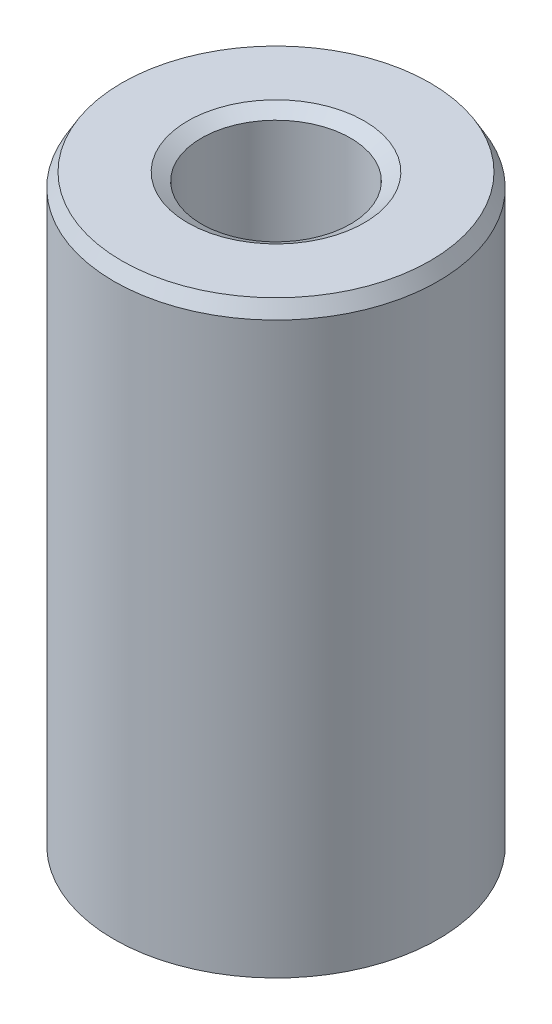
from build123d import *
from OCP.BRepFilletAPI import BRepFilletAPI_MakeChamfer

# Parameters (mm, degrees)
SKETCH1_R           = 35
BOSS_EXTRUDE1_DEPTH = 127.703927826
SKETCH2_R           = 16.094122096
CUT_EXTRUDE1_DEPTH  = 137.960918449
CHAMFER1_SIZE       = 2.970908828
CHAMFER1_SIZE2      = 1.715255011


with BuildPart() as part:
    # Sketch1 → Boss-Extrude1 (new body)
    with BuildSketch(Plane(origin=(0, 0, 0), x_dir=(1, 0, 0), z_dir=(0, 1, 0))):
        Circle(SKETCH1_R)
    extrude(amount=BOSS_EXTRUDE1_DEPTH)

    # Sketch2 → Cut-Extrude1 (cut, through all)
    with BuildSketch(Plane(origin=(0, 0, 0), x_dir=(1, 0, 0), z_dir=(0, 1, 0))):
        Circle(SKETCH2_R)
    extrude(amount=CUT_EXTRUDE1_DEPTH, mode=Mode.SUBTRACT)

    # Chamfer1: one chamfer whose edges measure the first distance from different faces: ONE call of the kernel's chamfer builder (chamfer() names one face for all edges)
    chamfer1_edges_1 = [part.edges().sort_by_distance(p)[0] for p in [
        (-16.094122096, 127.703927826, 0),
    ]]
    chamfer1_side_1 = [part.faces().sort_by_distance(p)[0] for p in [
        (-34.010050506, 127.703927826, 0),
    ]]
    chamfer1_edges_2 = [part.edges().sort_by_distance(p)[0] for p in [
        (-16.094122096, 0, 0),
    ]]
    chamfer1_side_2 = [part.faces().sort_by_distance(p)[0] for p in [
        (-16.094122096, 63.851963913, 0),
    ]]
    chamfer1_edges_3 = [part.edges().sort_by_distance(p)[0] for p in [
        (-35, 0, 0),
    ]]
    chamfer1_side_3 = [part.faces().sort_by_distance(p)[0] for p in [
        (-34.010050506, 0, 0),
    ]]
    chamfer1_edges_4 = [part.edges().sort_by_distance(p)[0] for p in [
        (-35, 127.703927826, 0),
    ]]
    chamfer1_side_4 = [part.faces().sort_by_distance(p)[0] for p in [
        (-35, 63.851963913, 0),
    ]]
    chamfer1 = BRepFilletAPI_MakeChamfer(part.part.solid().wrapped)
    for e in chamfer1_edges_1:
        chamfer1.Add(CHAMFER1_SIZE, CHAMFER1_SIZE2, e.wrapped, chamfer1_side_1[0].wrapped)  # the first distance lies on this face
    for e in chamfer1_edges_2:
        chamfer1.Add(CHAMFER1_SIZE, CHAMFER1_SIZE2, e.wrapped, chamfer1_side_2[0].wrapped)  # the first distance lies on this face
    for e in chamfer1_edges_3:
        chamfer1.Add(CHAMFER1_SIZE, CHAMFER1_SIZE2, e.wrapped, chamfer1_side_3[0].wrapped)  # the first distance lies on this face
    for e in chamfer1_edges_4:
        chamfer1.Add(CHAMFER1_SIZE, CHAMFER1_SIZE2, e.wrapped, chamfer1_side_4[0].wrapped)  # the first distance lies on this face
    add(Compound.cast(chamfer1.Shape()), mode=Mode.REPLACE)


solid = part.part
